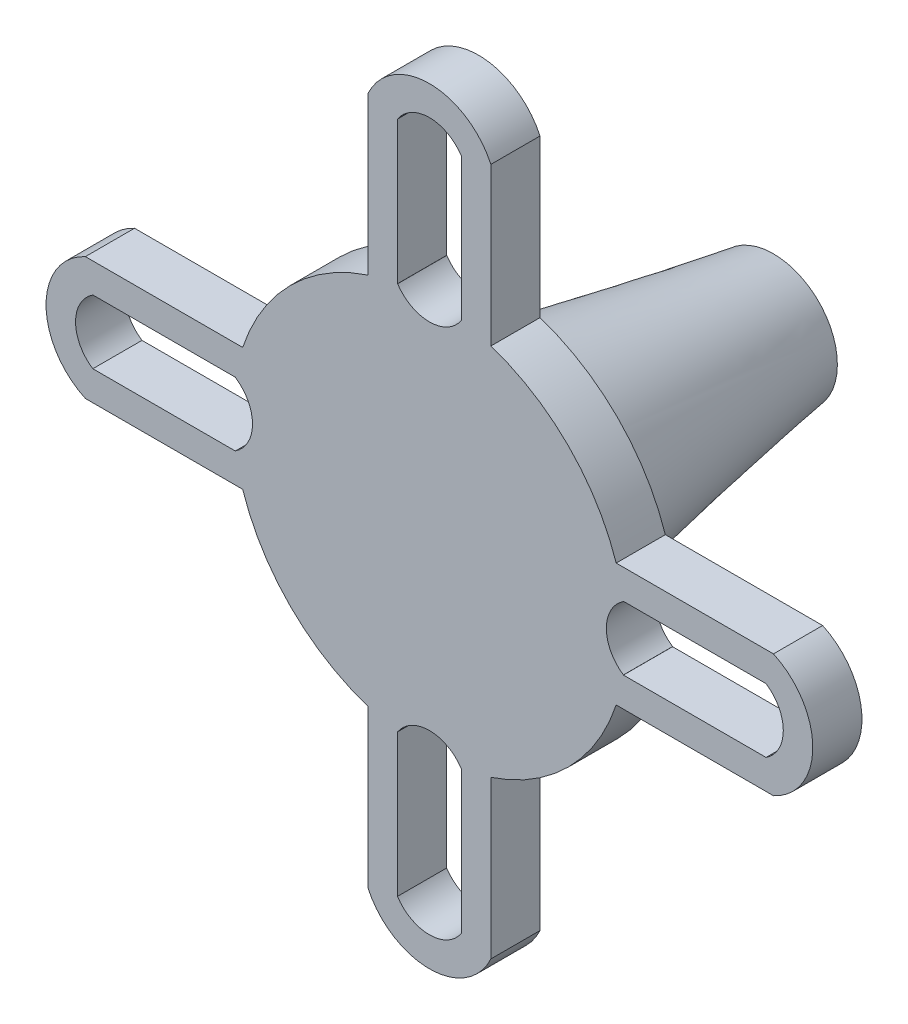
from build123d import *

# Parameters (mm, degrees)
BOSS_EXTRUDE1_DEPTH = 2.5
SKETCH16_R          = 2.75
CUT_EXTRUDE2_DEPTH  = 15


with BuildPart() as part:
    # Sketch1 → Boss-Extrude1 (new body)
    with BuildSketch(Plane.XY):
        with BuildLine():
            Line((3.125, -17.5), (3.125, -9.499177596))
            ThreePointArc((3.125, -9.499177596), (7.071067812, -7.071067812), (9.499177596, -3.125))
            Line((9.499177596, -3.125), (17.5, -3.125))
            ThreePointArc((17.5, -3.125), (19.5, 0), (17.5, 3.125))
            Line((17.5, 3.125), (9.499177596, 3.125))
            ThreePointArc((9.499177596, 3.125), (7.071067812, 7.071067812), (3.125, 9.499177596))
            Line((3.125, 9.499177596), (3.125, 17.5))
            ThreePointArc((3.125, 17.5), (0, 19.5), (-3.125, 17.5))
            Line((-3.125, 17.5), (-3.125, 9.499177596))
            ThreePointArc((-3.125, 9.499177596), (-7.071067812, 7.071067812), (-9.499177596, 3.125))
            Line((-9.499177596, 3.125), (-17.5, 3.125))
            ThreePointArc((-17.5, 3.125), (-19.5, 0), (-17.5, -3.125))
            Line((-17.5, -3.125), (-9.499177596, -3.125))
            ThreePointArc((-9.499177596, -3.125), (-7.071067812, -7.071067812), (-3.125, -9.499177596))
            Line((-3.125, -9.499177596), (-3.125, -17.5))
            ThreePointArc((-3.125, -17.5), (0, -19.5), (3.125, -17.5))
        make_face()
        with BuildLine():
            ThreePointArc((-9.868180698, -1.618335477), (-9.86763363, -1.621667831), (-9.867085436, -1.625))
            Line((-9.867085436, -1.625), (-9.878306468, -1.625))
            Line((-9.878306468, -1.625), (-17.120871128, -1.625))
            ThreePointArc((-17.120871128, -1.625), (-18, 0), (-17.120871128, 1.625))
            Line((-17.120871128, 1.625), (-9.878306468, 1.625))
            Line((-9.878306468, 1.625), (-9.867085436, 1.625))
            ThreePointArc((-9.867085436, 1.625), (-9.86763363, 1.621667831), (-9.868180698, 1.618335477))
            ThreePointArc((-9.868180698, 1.618335477), (-8.999177596, 0), (-9.868180698, -1.618335477))
        make_face(mode=Mode.SUBTRACT)
        with BuildLine():
            ThreePointArc((-1.618335477, -9.868180698), (0, -8.999177596), (1.618335477, -9.868180698))
            ThreePointArc((1.618335477, -9.868180698), (1.621667831, -9.86763363), (1.625, -9.867085436))
            Line((1.625, -9.867085436), (1.625, -9.878306468))
            Line((1.625, -9.878306468), (1.625, -17.120871128))
            ThreePointArc((1.625, -17.120871128), (0, -18), (-1.625, -17.120871128))
            Line((-1.625, -17.120871128), (-1.625, -9.878306468))
            Line((-1.625, -9.878306468), (-1.625, -9.867085436))
            ThreePointArc((-1.625, -9.867085436), (-1.621667831, -9.86763363), (-1.618335477, -9.868180698))
        make_face(mode=Mode.SUBTRACT)
        with BuildLine():
            Line((1.625, 9.878306468), (1.625, 9.867085436))
            ThreePointArc((1.625, 9.867085436), (1.621667831, 9.86763363), (1.618335477, 9.868180698))
            ThreePointArc((1.618335477, 9.868180698), (0, 8.999177596), (-1.618335477, 9.868180698))
            ThreePointArc((-1.618335477, 9.868180698), (-1.621667831, 9.86763363), (-1.625, 9.867085436))
            Line((-1.625, 9.867085436), (-1.625, 9.878306468))
            Line((-1.625, 9.878306468), (-1.625, 17.120871128))
            ThreePointArc((-1.625, 17.120871128), (0, 18), (1.625, 17.120871128))
            Line((1.625, 17.120871128), (1.625, 9.878306468))
        make_face(mode=Mode.SUBTRACT)
        with BuildLine():
            ThreePointArc((9.868180698, 1.618335477), (9.86763363, 1.621667831), (9.867085436, 1.625))
            Line((9.867085436, 1.625), (9.878306468, 1.625))
            Line((9.878306468, 1.625), (17.120871128, 1.625))
            ThreePointArc((17.120871128, 1.625), (18, 0), (17.120871128, -1.625))
            Line((17.120871128, -1.625), (9.878306468, -1.625))
            Line((9.878306468, -1.625), (9.867085436, -1.625))
            ThreePointArc((9.867085436, -1.625), (9.86763363, -1.621667831), (9.868180698, -1.618335477))
            ThreePointArc((9.868180698, -1.618335477), (8.999177596, 0), (9.868180698, 1.618335477))
        make_face(mode=Mode.SUBTRACT)
    extrude(amount=BOSS_EXTRUDE1_DEPTH)

    # Loft2: read off the stored shape, not the designer's step
    # Loft2: loft between two sections, ruled curve by curve
    loft2_from = [
        Edge.make_bspline([(3.048060313, 1.127753665, -15), (0.792552983, 7.223874291, -15), (-5.303567643, 4.968366961, -15), (-3.048060313, -1.127753665, -15), (-0.792552983, -7.223874291, -15), (5.303567643, -4.968366961, -15), (3.048060313, 1.127753665, -15)], [0, 0, 0, 0, 0.5, 0.5, 0.5, 1, 1, 1, 1], 3, [1, 0.333333333, 0.333333333, 1, 0.333333333, 0.333333333, 1]),
    ]
    loft2_to = [
        Edge.make_bspline([(4.41488096, 4.063105476, 0), (-3.711329991, 12.892867396, 0), (-12.541091911, 4.766656445, 0), (-4.41488096, -4.063105476, 0), (3.711329991, -12.892867396, 0), (12.541091911, -4.766656445, 0), (4.41488096, 4.063105476, 0)], [0, 0, 0, 0, 0.5, 0.5, 0.5, 1, 1, 1, 1], 3, [1, 0.333333333, 0.333333333, 1, 0.333333333, 0.333333333, 1]),
    ]
    loft2 = Solid(Shell([*[Face.make_surface_from_curves(loft2_from[k], loft2_to[k]) for k in range(1)], Face(Wire(loft2_from)), Face(Wire(loft2_to))]))
    add(loft2)

    # Sketch16 → Cut-Extrude2 (cut)
    with BuildSketch(Plane(origin=(0, 0, -15), x_dir=(-1, 0, 0), z_dir=(0, 0, -1))):
        Circle(SKETCH16_R)
    extrude(amount=-CUT_EXTRUDE2_DEPTH, mode=Mode.SUBTRACT)


solid = part.part
